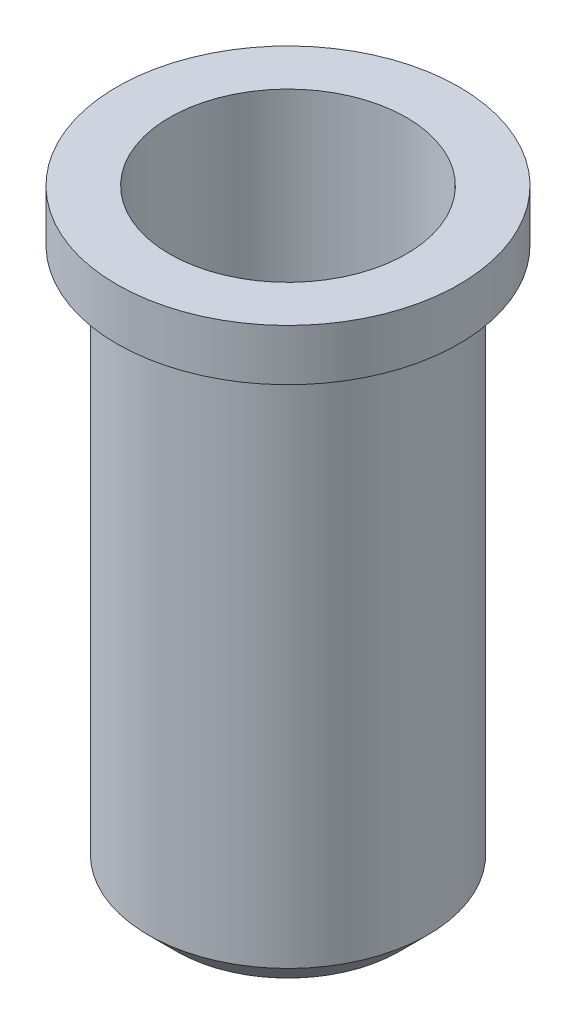
from build123d import *


with BuildPart() as part:
    # Sketch1 → Revolve1 (revolve)
    with BuildSketch(Plane.XY):
        Polygon((0, 0.254), (0, 0), (0.9906, 0), (1.2446, 0.254), (1.2446, 4.953), (1.524, 4.953), (1.524, 5.4102), (1.0541, 5.4102), (1.0541, 0.8382), align=None)
    revolve(axis=Axis((0, 0, 0), (0, 1, 0)))


solid = part.part
